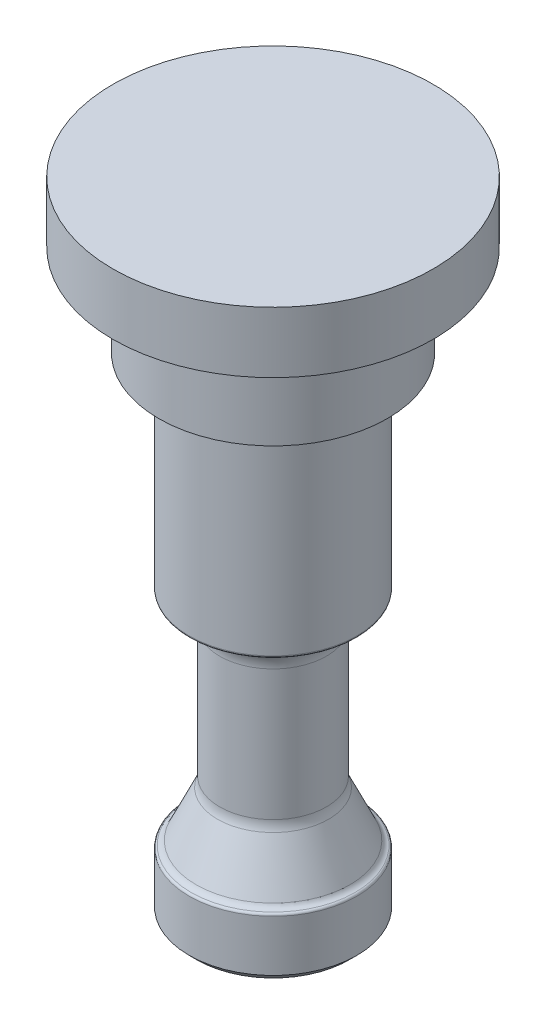
from build123d import *

# Parameters (mm, degrees)
SKETCH1_R               = 8.73125
MAIN_DEPTH              = 50.8
CHAMFER1_SIZE           = 0.79375
FILLET1_R               = 0.254
SKETCH6_R               = 11.90625
SPRING_STABILIZER_DEPTH = 9.525
SKETCH3_R               = 16.66875
TOP_CAP_DEPTH           = 6.35
FILLET2_R               = 1.27
SKETCH7_R               = 2.38125
CUT_EXTRUDE1_DEPTH      = 19.05


with BuildPart() as part:
    # Sketch1 → main (new body)
    with BuildSketch(Plane(origin=(0, 0, 0), x_dir=(1, 0, 0), z_dir=(0, 1, 0))):
        Circle(SKETCH1_R)
    extrude(amount=MAIN_DEPTH)

    # Chamfer1
    chamfer1_edges = [part.edges().sort_by_distance(p)[0] for p in [
        (-8.73125, 0, 0),
    ]]
    chamfer(chamfer1_edges, length=CHAMFER1_SIZE)

    # Sketch2 → ball_channel (revolve, cut)
    with BuildSketch(Plane(origin=(0, 0, 0), x_dir=(0, 0, -1), z_dir=(1, 0, 0))):
        with BuildLine():
            Line((-5.779354582, 11.595937646), (-8.011868194, 6.808296755))
            ThreePointArc((-8.011868194, 6.808296755), (-8.304768436, 6.47430804), (-8.73125, 6.35))
            Line((-8.73125, 6.35), (-8.73125, 29.36875))
            ThreePointArc((-8.73125, 29.36875), (-6.48618597, 28.43881403), (-5.55625, 26.19375))
            Line((-5.55625, 26.19375), (-5.55625, 12.602297381))
            ThreePointArc((-5.55625, 12.602297381), (-5.612695133, 12.086900551), (-5.779354582, 11.595937646))
        make_face()
    revolve(axis=Axis((0, 50.8, 0), (0, -1, 0)), mode=Mode.SUBTRACT)

    # Fillet1
    fillet1_edges = [part.edges().sort_by_distance(p)[0] for p in [
        (6.173926083, 29.36875, 6.173926083),
        (-8.73125, 50.8, 0),
        (6.173926083, 6.35, 6.173926083),
    ]]
    fillet(fillet1_edges, radius=FILLET1_R)

    # Sketch6 → spring_stabilizer (add)
    with BuildSketch(Plane(origin=(0, 50.8, 0), x_dir=(1, 0, 0), z_dir=(0, 1, 0))):
        Circle(SKETCH6_R)
    extrude(amount=SPRING_STABILIZER_DEPTH)

    # Sketch3 → top_cap (add)
    with BuildSketch(Plane(origin=(0, 60.325, 0), x_dir=(1, 0, 0), z_dir=(0, 1, 0))):
        Circle(SKETCH3_R)
    extrude(amount=TOP_CAP_DEPTH)

    # Fillet2
    fillet2_edges = [part.edges().sort_by_distance(p)[0] for p in [
        (-11.90625, 60.325, 0),
    ]]
    fillet(fillet2_edges, radius=FILLET2_R)

    # Sketch7 → Cut-Extrude1 (cut)
    with BuildSketch(Plane.XZ):
        Circle(SKETCH7_R)
    extrude(amount=-CUT_EXTRUDE1_DEPTH, mode=Mode.SUBTRACT)


solid = part.part
